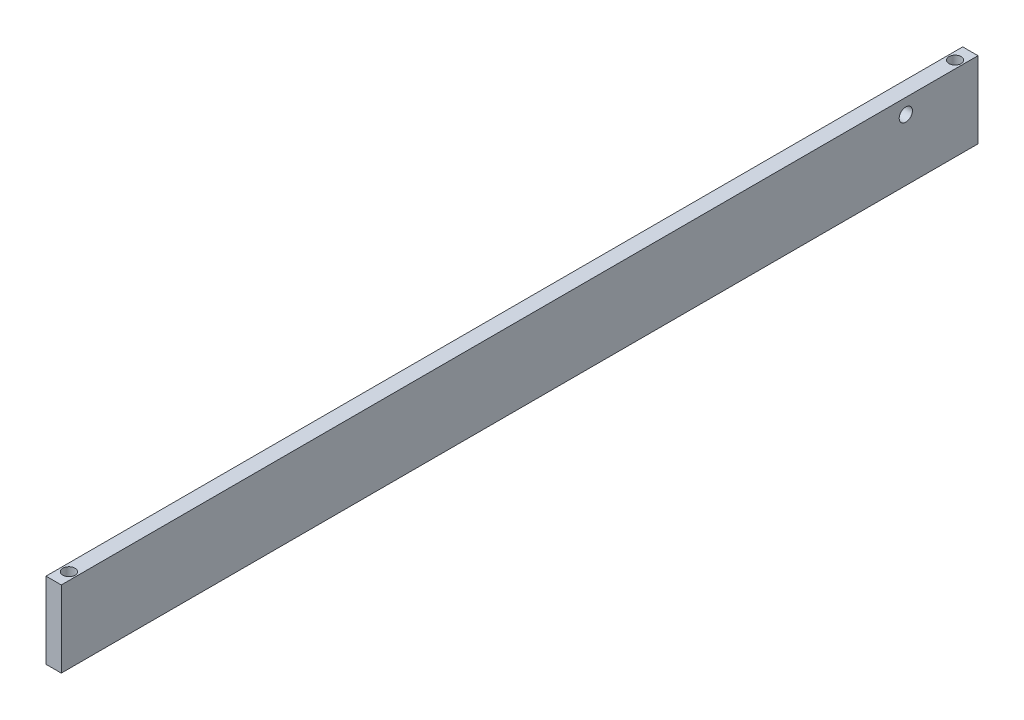
from build123d import *

# Parameters (mm, degrees)
SKETCH1_W           = 6.35
SKETCH1_H           = 31.75
BOSS_EXTRUDE1_DEPTH = 381
CUT_EXTRUDE1_REACH  = 384.373
SKETCH2_R           = 2.75
SKETCH3_R           = 2.54
CUT_EXTRUDE2_DEPTH  = 7.62


with BuildPart() as part:
    # Sketch1 → Boss-Extrude1 (new body)
    with BuildSketch(Plane.XY):
        with Locations((-3.175, 15.875)):
            Rectangle(SKETCH1_W, SKETCH1_H)
    extrude(amount=-BOSS_EXTRUDE1_DEPTH)

    # Sketch2 → Cut-Extrude1 (cut, up to next)
    with BuildSketch(Plane.ZY.offset(6.35), mode=Mode.PRIVATE) as cut_extrude1_sk1:
        with Locations((-351, 25.5625)):
            Circle(SKETCH2_R)
    cut_extrude1_tool1 = extrude(cut_extrude1_sk1.sketch, amount=-CUT_EXTRUDE1_REACH, mode=Mode.PRIVATE) & part.part
    add(cut_extrude1_tool1.solids().sort_by_distance((-6.35, 25.5625, -351))[0], mode=Mode.SUBTRACT)

    # Sketch3 → Cut-Extrude2 (cut)
    with BuildSketch(Plane(origin=(0, 31.75, 0), x_dir=(1, 0, 0), z_dir=(0, 1, 0))):
        with Locations((-3.175, 6.35)):
            Circle(SKETCH3_R)
        with Locations((-3.175, 374.65)):
            Circle(SKETCH3_R)
    extrude(amount=-CUT_EXTRUDE2_DEPTH, mode=Mode.SUBTRACT)


solid = part.part
